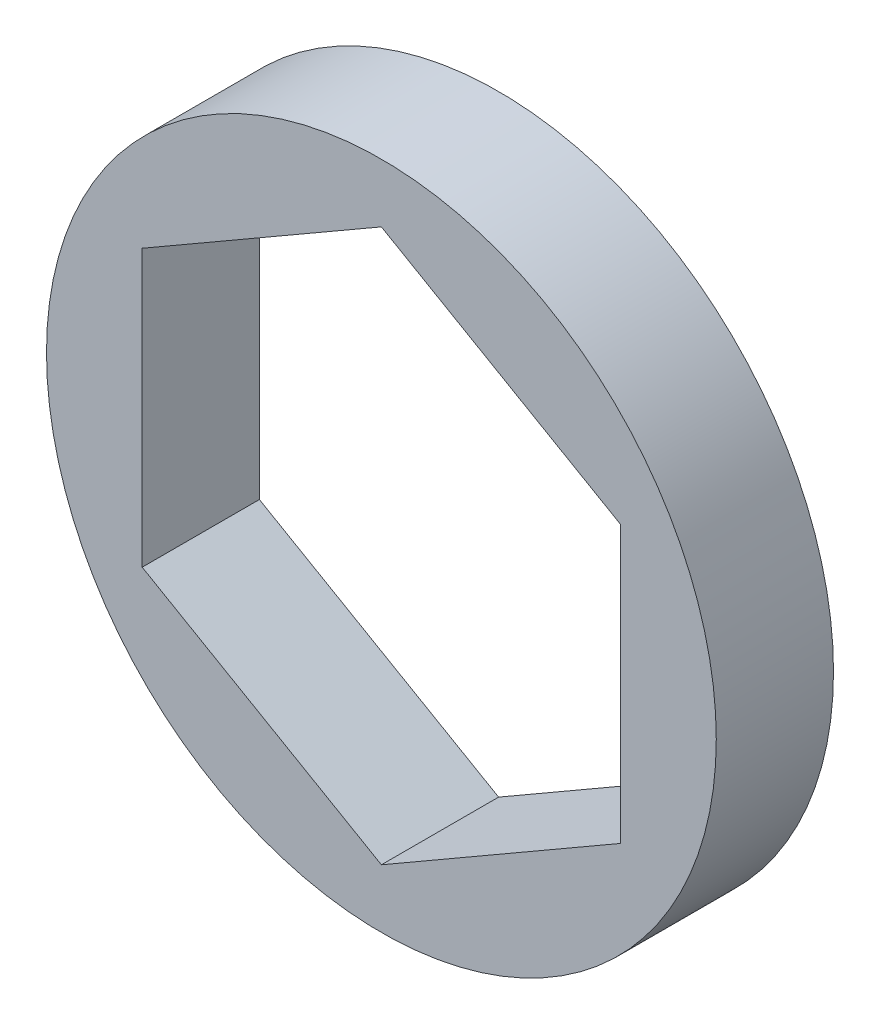
from build123d import *

# Parameters (mm, degrees)
SKETCH1_R           = 8.89
BOSS_EXTRUDE1_DEPTH = 1.55575


with BuildPart() as part:
    # Sketch1 → Boss-Extrude1 (new, symmetric)
    with BuildSketch(Plane.XY):
        Circle(SKETCH1_R)
        Polygon((0, 7.332348419), (-6.35, 3.666174209), (-6.35, -3.666174209), (0, -7.332348419), (6.35, -3.666174209), (6.35, 3.666174209), align=None, mode=Mode.SUBTRACT)
    extrude(amount=BOSS_EXTRUDE1_DEPTH, both=True)


solid = part.part
